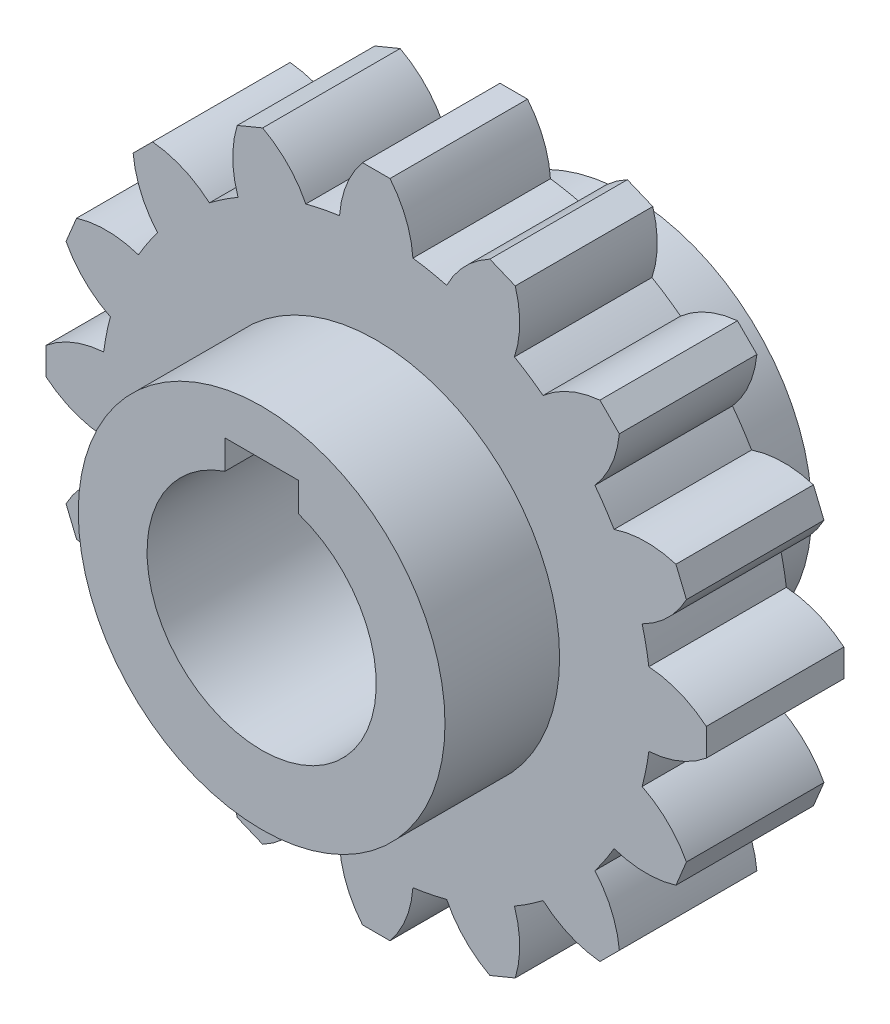
from build123d import *

# Parameters (mm, degrees)
BOSS_EXTRUDE1_DEPTH     = 7.5
SKETCH2_R               = 20
BOSS_EXTRUDE2_DEPTH     = 20
CUT_EXTRUDE1_DEPTH      = 65.745656225
CUT_EXTRUDE1_DEPTH_BACK = 65.745656225


with BuildPart() as part:
    # Sketch1 → Boss-Extrude1 (new, symmetric)
    with BuildSketch(Plane.XY):
        with BuildLine():
            Line((-1.5, 36), (1.5, 36))
            ThreePointArc((1.5, 36), (3.242504384, 33.062509074), (4, 29.732137495))
            ThreePointArc((4, 29.732137495), (5.85270966, 29.423558412), (7.682478298, 28.999647019))
            ThreePointArc((7.682478298, 28.999647019), (9.656791021, 31.786628134), (12.390784266, 33.833688319))
            Line((12.390784266, 33.833688319), (15.162422864, 32.685638022))
            ThreePointArc((15.162422864, 32.685638022), (15.64815789, 29.30492272), (15.073514558, 25.93817956))
            ThreePointArc((15.073514558, 25.93817956), (16.667106991, 24.944088369), (18.195368917, 23.852223166))
            ThreePointArc((18.195368917, 23.852223166), (21.085927531, 25.671521208), (24.395183951, 26.516504294))
            Line((24.395183951, 26.516504294), (26.516504294, 24.395183951))
            ThreePointArc((26.516504294, 24.395183951), (25.671521208, 21.085927531), (23.852223166, 18.195368917))
            ThreePointArc((23.852223166, 18.195368917), (24.944088369, 16.667106991), (25.93817956, 15.073514558))
            ThreePointArc((25.93817956, 15.073514558), (29.30492272, 15.64815789), (32.685638022, 15.162422864))
            Line((32.685638022, 15.162422864), (33.833688319, 12.390784266))
            ThreePointArc((33.833688319, 12.390784266), (31.786628134, 9.656791021), (28.999647019, 7.682478298))
            ThreePointArc((28.999647019, 7.682478298), (29.423558412, 5.85270966), (29.732137495, 4))
            ThreePointArc((29.732137495, 4), (33.062509074, 3.242504384), (36, 1.5))
            Line((36, 1.5), (36, -1.5))
            ThreePointArc((36, -1.5), (33.062509074, -3.242504384), (29.732137495, -4))
            ThreePointArc((29.732137495, -4), (29.423558412, -5.85270966), (28.999647019, -7.682478298))
            ThreePointArc((28.999647019, -7.682478298), (31.786628134, -9.656791021), (33.833688319, -12.390784266))
            Line((33.833688319, -12.390784266), (32.685638022, -15.162422864))
            ThreePointArc((32.685638022, -15.162422864), (29.30492272, -15.64815789), (25.93817956, -15.073514558))
            ThreePointArc((25.93817956, -15.073514558), (24.944088369, -16.667106991), (23.852223166, -18.195368917))
            ThreePointArc((23.852223166, -18.195368917), (25.671521208, -21.085927531), (26.516504294, -24.395183951))
            Line((26.516504294, -24.395183951), (24.395183951, -26.516504294))
            ThreePointArc((24.395183951, -26.516504294), (21.085927531, -25.671521208), (18.195368917, -23.852223166))
            ThreePointArc((18.195368917, -23.852223166), (16.667106991, -24.944088369), (15.073514558, -25.93817956))
            ThreePointArc((15.073514558, -25.93817956), (15.64815789, -29.30492272), (15.162422864, -32.685638022))
            Line((15.162422864, -32.685638022), (12.390784266, -33.833688319))
            ThreePointArc((12.390784266, -33.833688319), (9.656791021, -31.786628134), (7.682478298, -28.999647019))
            ThreePointArc((7.682478298, -28.999647019), (5.85270966, -29.423558412), (4, -29.732137495))
            ThreePointArc((4, -29.732137495), (3.242504384, -33.062509074), (1.5, -36))
            Line((1.5, -36), (-1.5, -36))
            ThreePointArc((-1.5, -36), (-3.242504384, -33.062509074), (-4, -29.732137495))
            ThreePointArc((-4, -29.732137495), (-5.85270966, -29.423558412), (-7.682478298, -28.999647019))
            ThreePointArc((-7.682478298, -28.999647019), (-9.656791021, -31.786628134), (-12.390784266, -33.833688319))
            Line((-12.390784266, -33.833688319), (-15.162422864, -32.685638022))
            ThreePointArc((-15.162422864, -32.685638022), (-15.64815789, -29.30492272), (-15.073514558, -25.93817956))
            ThreePointArc((-15.073514558, -25.93817956), (-16.667106991, -24.944088369), (-18.195368917, -23.852223166))
            ThreePointArc((-18.195368917, -23.852223166), (-21.085927531, -25.671521208), (-24.395183951, -26.516504294))
            Line((-24.395183951, -26.516504294), (-26.516504294, -24.395183951))
            ThreePointArc((-26.516504294, -24.395183951), (-25.671521208, -21.085927531), (-23.852223166, -18.195368917))
            ThreePointArc((-23.852223166, -18.195368917), (-24.944088369, -16.667106991), (-25.93817956, -15.073514558))
            ThreePointArc((-25.93817956, -15.073514558), (-29.30492272, -15.64815789), (-32.685638022, -15.162422864))
            Line((-32.685638022, -15.162422864), (-33.833688319, -12.390784266))
            ThreePointArc((-33.833688319, -12.390784266), (-31.786628134, -9.656791021), (-28.999647019, -7.682478298))
            ThreePointArc((-28.999647019, -7.682478298), (-29.423558412, -5.85270966), (-29.732137495, -4))
            ThreePointArc((-29.732137495, -4), (-33.062509074, -3.242504384), (-36, -1.5))
            Line((-36, -1.5), (-36, 1.5))
            ThreePointArc((-36, 1.5), (-33.062509074, 3.242504384), (-29.732137495, 4))
            ThreePointArc((-29.732137495, 4), (-29.423558412, 5.85270966), (-28.999647019, 7.682478298))
            ThreePointArc((-28.999647019, 7.682478298), (-31.786628134, 9.656791021), (-33.833688319, 12.390784266))
            Line((-33.833688319, 12.390784266), (-32.685638022, 15.162422864))
            ThreePointArc((-32.685638022, 15.162422864), (-29.30492272, 15.64815789), (-25.93817956, 15.073514558))
            ThreePointArc((-25.93817956, 15.073514558), (-24.944088369, 16.667106991), (-23.852223166, 18.195368917))
            ThreePointArc((-23.852223166, 18.195368917), (-25.671521208, 21.085927531), (-26.516504294, 24.395183951))
            Line((-26.516504294, 24.395183951), (-24.395183951, 26.516504294))
            ThreePointArc((-24.395183951, 26.516504294), (-21.085927531, 25.671521208), (-18.195368917, 23.852223166))
            ThreePointArc((-18.195368917, 23.852223166), (-16.667106991, 24.944088369), (-15.073514558, 25.93817956))
            ThreePointArc((-15.073514558, 25.93817956), (-15.64815789, 29.30492272), (-15.162422864, 32.685638022))
            Line((-15.162422864, 32.685638022), (-12.390784266, 33.833688319))
            ThreePointArc((-12.390784266, 33.833688319), (-9.656791021, 31.786628134), (-7.682478298, 28.999647019))
            ThreePointArc((-7.682478298, 28.999647019), (-5.85270966, 29.423558412), (-4, 29.732137495))
            ThreePointArc((-4, 29.732137495), (-3.242504384, 33.062509074), (-1.5, 36))
        make_face()
    extrude(amount=BOSS_EXTRUDE1_DEPTH, both=True)

    # Sketch2 → Boss-Extrude2 (add, symmetric)
    with BuildSketch(Plane.XY):
        Circle(SKETCH2_R)
    extrude(amount=BOSS_EXTRUDE2_DEPTH, both=True)

    # Sketch3 → Cut-Extrude1 (cut, two sides: drawn at the far end of the back side and taken through both)
    with BuildSketch(Plane.XY.offset(20).offset(-CUT_EXTRUDE1_DEPTH_BACK)):
        with BuildLine():
            Line((-4, 15), (-4, 11.842719282))
            ThreePointArc((-4, 11.842719282), (0, -12.5), (4, 11.842719282))
            Line((4, 11.842719282), (4, 15))
            Line((4, 15), (-4, 15))
        make_face()
    extrude(amount=CUT_EXTRUDE1_DEPTH + CUT_EXTRUDE1_DEPTH_BACK, mode=Mode.SUBTRACT)


solid = part.part
